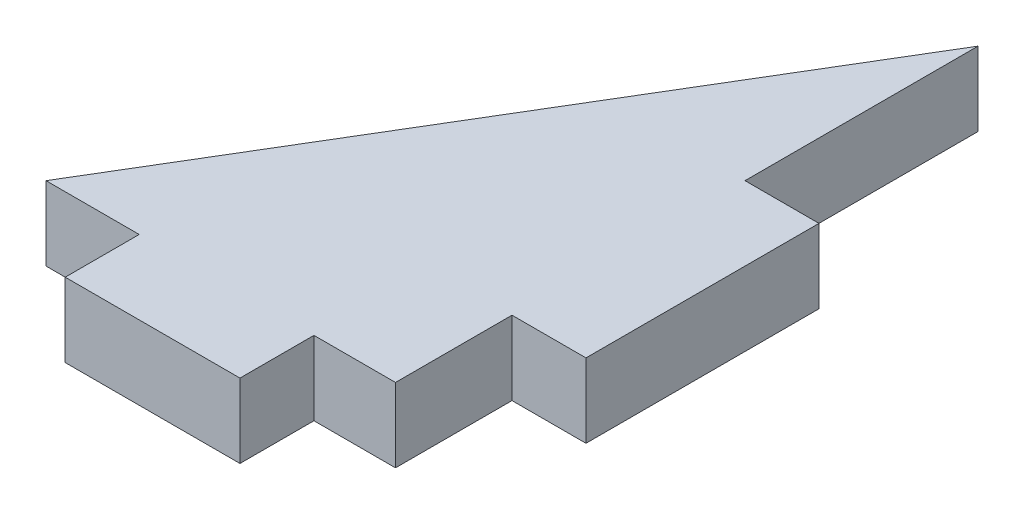
from build123d import *

# Parameters (mm, degrees)
BOSS_EXTRU_1_DEPTH = 6.35
ESQUISSE2_W        = 20
ESQUISSE2_H        = 6.35
BOSS_EXTRU_2_DEPTH = 6.35
ESQUISSE3_W        = 15
ESQUISSE3_H        = 6.35
BOSS_EXTRU_3_DEPTH = 6.35


with BuildPart() as part:
    # Esquisse1 → Boss.-Extru.1 (new body)
    with BuildSketch(Plane(origin=(0, 0, 0), x_dir=(1, 0, 0), z_dir=(0, 1, 0))):
        Polygon((-30, 0), (0, 0), (0, 50), align=None)
    extrude(amount=BOSS_EXTRU_1_DEPTH)

    # Esquisse2 → Boss.-Extru.2 (add)
    with BuildSketch(Plane(origin=(0, 0, 0), x_dir=(0, 0, -1), z_dir=(1, 0, 0))):
        with Locations((20, 3.175)):
            Rectangle(ESQUISSE2_W, ESQUISSE2_H)
    extrude(amount=BOSS_EXTRU_2_DEPTH)

    # Esquisse3 → Boss.-Extru.3 (add)
    with BuildSketch(Plane.XY):
        with Locations((-14.5, 3.175)):
            Rectangle(ESQUISSE3_W, ESQUISSE3_H)
    extrude(amount=BOSS_EXTRU_3_DEPTH)


solid = part.part
